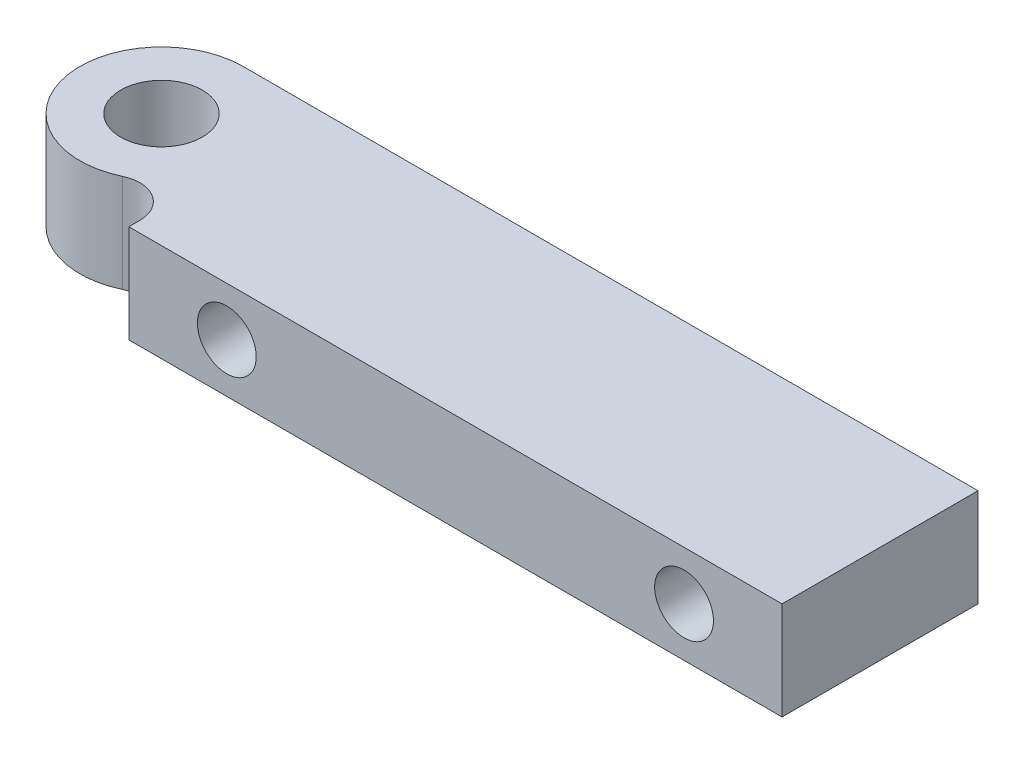
from build123d import *

# Parameters (mm, degrees)
SKETCH1_R           = 3.175
BOSS_EXTRUDE1_DEPTH = 3.8099999999999996
FILLET1_R           = 2.54
SKETCH2_R           = 2.2859999999994676
SKETCH2_R_2         = 2.285999999999461
CUT_EXTRUDE1_DEPTH  = 5.08


with BuildPart() as part:
    # Sketch1 → Boss-Extrude1 (new, symmetric)
    with BuildSketch(Plane(origin=(0, 0, 0), x_dir=(1, 0, 0), z_dir=(0, 1, 0))):
        with BuildLine():
            Line((0, 6.35), (12.366459894249573, 6.35))
            Line((12.366459894249573, 6.35), (57.15, 6.35))
            Line((57.15, 6.35), (57.15, -8.889999999999999))
            Line((57.15, -8.889999999999999), (6.350000000000001, -8.889999999999999))
            Line((6.350000000000001, -8.889999999999999), (6.3500000000000005, 8.7e-16))
            ThreePointArc((6.3500000000000005, 8.7e-16), (-4.490128060534578, -4.490128060534576), (0, 6.35))
        make_face()
        Circle(SKETCH1_R, mode=Mode.SUBTRACT)
    extrude(amount=BOSS_EXTRUDE1_DEPTH, both=True)

    # Fillet1
    fillet1_edges = [part.edges().sort_by_distance(p)[0] for p in [
        (6.350000000000001, 0, -8.7e-16),
    ]]
    fillet(fillet1_edges, radius=FILLET1_R)

    # Sketch2 → Cut-Extrude1 (cut)
    with BuildSketch(Plane.XY.offset(8.889999999999999)):
        with Locations((13.970000000000649, 1.865e-14)):
            Circle(SKETCH2_R)
        with Locations((49.53000000000068, 1.865e-14)):
            Circle(SKETCH2_R_2)
    extrude(amount=-CUT_EXTRUDE1_DEPTH, mode=Mode.SUBTRACT)


solid = part.part
